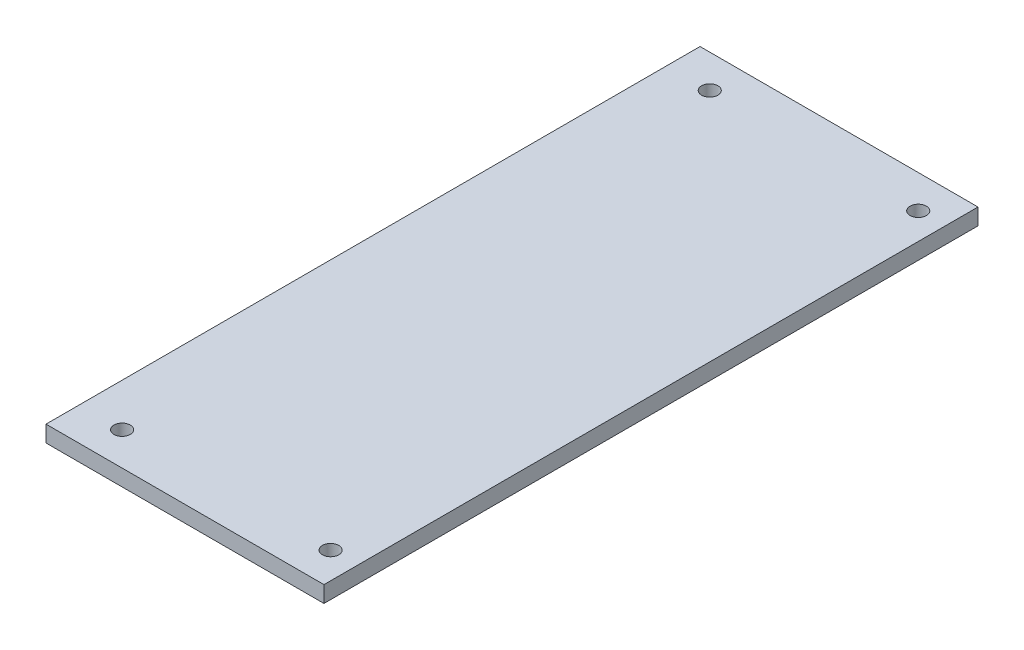
from build123d import *

# Parameters (mm, degrees)
STOCK_BASE_1_OUTLINE_W = 80
STOCK_BASE_1_OUTLINE_H = 200
STOCK_BASE_1_DEPTH     = 5
SKETCH1_R              = 2.5
CUT_EXTRUDE2_DEPTH     = 10
SKETCH3_W              = 200
SKETCH3_H              = 5
BOSS_EXTRUDE1_DEPTH    = 5


# Read off the part's stored shape, not the designer's step: Stock-Base-1
with BuildPart() as part:
    # Stock-Base-1 outline → Stock-Base-1 (new body)
    with BuildSketch(Plane(origin=(0, 0, 0), x_dir=(1, 0, 0), z_dir=(0, 1, 0))):
        with Locations((-34.993542676, -71.036319336)):
            Rectangle(STOCK_BASE_1_OUTLINE_W, STOCK_BASE_1_OUTLINE_H)
    extrude(amount=STOCK_BASE_1_DEPTH)

    # Sketch1 → Cut-Extrude2 (cut)
    with BuildSketch(Plane(origin=(0, 5, 0), x_dir=(1, 0, 0), z_dir=(0, 1, 0))):
        with Locations(Location((-66.872507057, 18.812386141, 0), (0, 0, 270))):
            Circle(SKETCH1_R)
        with Locations(Location((-3.114578294, 18.812386141, 0), (0, 0, 270))):
            Circle(SKETCH1_R)
        with Locations(Location((-3.114578294, -160.885024814, 0), (0, 0, 270))):
            Circle(SKETCH1_R)
        with Locations(Location((-66.872507057, -160.885024814, 0), (0, 0, 270))):
            Circle(SKETCH1_R)
    extrude(amount=-CUT_EXTRUDE2_DEPTH, mode=Mode.SUBTRACT)

    # Sketch3 → Boss-Extrude1 (add)
    with BuildSketch(Plane.ZY.offset(74.993542676)):
        with Locations((71.036319336, 2.5)):
            Rectangle(SKETCH3_W, SKETCH3_H)
    extrude(amount=BOSS_EXTRUDE1_DEPTH)


solid = part.part
